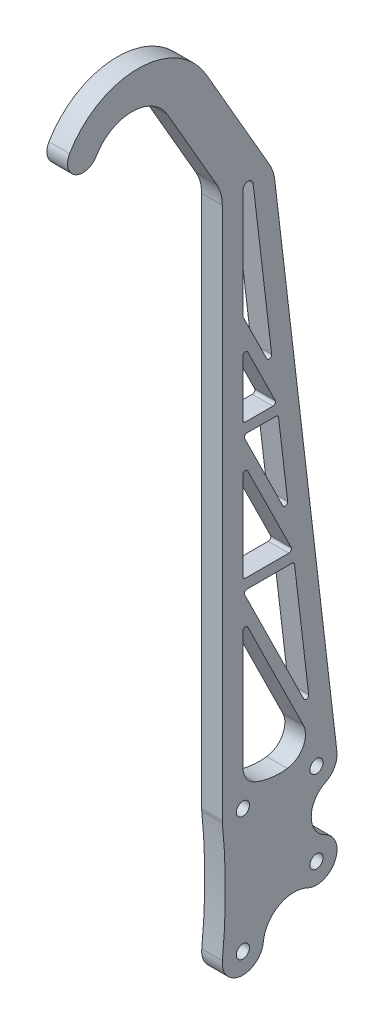
from build123d import *

# Parameters (mm, degrees)
BOSS_EXTRUDE1_DEPTH = 3.175
SKETCH2_R           = 2.032
CUT_EXTRUDE1_DEPTH  = 242.929632893
FILLET1_R           = 12.7
FILLET2_R           = 0.79375
FILLET3_R           = 6.35


with BuildPart() as part:
    # Sketch1 → Boss-Extrude1 (new, symmetric)
    with BuildSketch(Plane(origin=(0, 0, 0), x_dir=(0, 0, -1), z_dir=(1, 0, 0))):
        with BuildLine():
            Line((-17.7, 19.05), (-17.7, 183.35625))
            ThreePointArc((-17.7, 183.35625), (-18.132742006, 186.643251873), (-19.401477372, 189.70625))
            Line((-19.401477372, 189.70625), (-34.524445986, 215.9))
            ThreePointArc((-34.524445986, 215.9), (-45.522968614, 222.25), (-56.521491242, 215.9))
            ThreePointArc((-56.521491242, 215.9), (-63.027187227, 214.156804014), (-64.770383213, 220.6625))
            ThreePointArc((-64.770383213, 220.6625), (-43.689881509, 232.833333333), (-22.609379805, 220.6625))
            Line((-22.609379805, 220.6625), (-1.825, 184.662898174))
            Line((-1.825, 184.662898174), (17.656128594, 19.795145732))
            ThreePointArc((17.656128594, 19.795145732), (16.917823934, 15.996831704), (14.112111824, 13.332199875))
            ThreePointArc((14.112111824, 13.332199875), (9.73081975, 6.35), (14.112111824, -0.632199875))
            ThreePointArc((14.112111824, -0.632199875), (17.067800125, -9.112111824), (8.587888176, -12.067800125))
            ThreePointArc((8.587888176, -12.067800125), (-0.205881062, -12.332007866), (-5.032111824, -19.687800125))
            ThreePointArc((-5.032111824, -19.687800125), (-11.987800125, -25.367888176), (-17.667888176, -18.412199875))
            ThreePointArc((-17.667888176, -18.412199875), (-16.740874674, 0), (-17.667888176, 18.412199875))
            ThreePointArc((-17.667888176, 18.412199875), (-17.691966963, 18.730696003), (-17.7, 19.05))
        make_face()
        with BuildLine():
            Line((-11.35, 25.4), (-11.35, 69.85))
            Line((-11.35, 69.85), (10.604854268, 25.356128594))
            ThreePointArc((10.604854268, 25.356128594), (9.571869946, 25.145962066), (8.587888176, 24.767800125))
            ThreePointArc((8.587888176, 24.767800125), (0, 22.802180275), (-8.587888176, 24.767800125))
            ThreePointArc((-8.587888176, 24.767800125), (-9.933230928, 25.239932584), (-11.35, 25.4))
        make_face(mode=Mode.SUBTRACT)
        Polygon((9.490062912, 34.790548391), (-11.35, 77.025175321), (4.499528462, 77.025175321), align=None, mode=Mode.SUBTRACT)
        Polygon((4.124363626, 80.200175321), (-11.35, 80.200175321), (-11.35, 111.560636058), align=None, mode=Mode.SUBTRACT)
        Polygon((3.00957227, 89.634595118), (-11.35, 118.735811379), (-0.429090099, 118.735811379), align=None, mode=Mode.SUBTRACT)
        Polygon((-0.804254935, 121.910811379), (-11.35, 121.910811379), (-11.35, 143.282896982), align=None, mode=Mode.SUBTRACT)
        with BuildLine():
            Line((-8.185967852, 184.381854159), (-1.919046291, 131.345231176))
            Line((-1.919046291, 131.345231176), (-11.35, 150.458072303))
            Line((-11.35, 150.458072303), (-11.35, 184.195567726))
            ThreePointArc((-11.35, 184.195567726), (-9.855804513, 185.780323391), (-8.185967852, 184.381854159))
        make_face(mode=Mode.SUBTRACT)
    extrude(amount=BOSS_EXTRUDE1_DEPTH, both=True)

    # Sketch2 → Cut-Extrude1 (cut, through all)
    with BuildSketch(Plane(origin=(3.175, 0, 0), x_dir=(0, 0, -1), z_dir=(1, 0, 0))):
        with Locations((11.35, -6.35)):
            Circle(SKETCH2_R)
        with Locations((11.35, 19.05)):
            Circle(SKETCH2_R)
        with Locations((-11.35, 19.05)):
            Circle(SKETCH2_R)
        with Locations((-11.35, -19.05)):
            Circle(SKETCH2_R)
    extrude(amount=-CUT_EXTRUDE1_DEPTH, mode=Mode.SUBTRACT)

    # Fillet1
    fillet1_edges = [part.edges().sort_by_distance(p)[0] for p in [
        (0, 184.662898174, 1.825),
    ]]
    fillet(fillet1_edges, radius=FILLET1_R)

    # Fillet2
    fillet2_edges = [part.edges().sort_by_distance(p)[0] for p in [
        (0, 121.910811379, 11.35),
        (0, 118.735811379, 11.35),
        (0, 118.735811379, 0.429090099),
        (0, 89.634595118, -3.00957227),
        (0, 111.560636058, 11.35),
        (0, 80.200175321, 11.35),
        (0, 80.200175321, -4.124363626),
        (0, 69.85, 11.35),
        (0, 77.025175321, 11.35),
        (0, 77.025175321, -4.499528462),
        (0, 34.790548391, -9.490062912),
        (0, 150.458072303, 11.35),
        (0, 121.910811379, 0.804254935),
        (0, 143.282896982, 11.35),
        (0, 131.345231176, 1.919046291),
    ]]
    fillet(fillet2_edges, radius=FILLET2_R)

    # Fillet3
    fillet3_edges = [part.edges().sort_by_distance(p)[0] for p in [
        (0, 25.4, 11.35),
        (0, 25.356128594, -10.604854268),
    ]]
    fillet(fillet3_edges, radius=FILLET3_R)


solid = part.part
